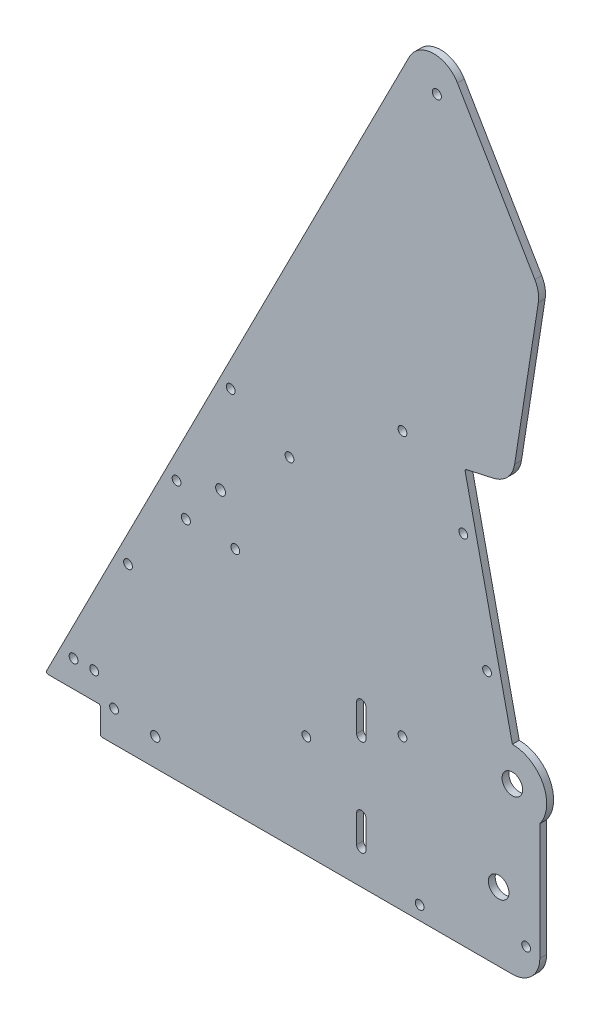
from build123d import *

# Parameters (mm, degrees)
BOSS_EXTRUDE1_DEPTH = 3.175
SKETCH2_R           = 2.0955
SKETCH2_R_2         = 2.286
SKETCH2_R_3         = 2.032
SKETCH2_R_4         = 4.7625
CUT_EXTRUDE1_DEPTH  = 421.976111717
SKETCH7_R           = 2.159
CUT_EXTRUDE2_DEPTH  = 421.976111717
CUT_EXTRUDE3_REACH  = 422.976
SKETCH10_R          = 2.032
FILLET1_R           = 12.7
FILLET2_R           = 0.79375
SKETCH12_R          = 2.032
CUT_EXTRUDE5_DEPTH  = 410.593447353


with BuildPart() as part:
    # Sketch1 → Boss-Extrude1 (new body)
    with BuildSketch(Plane.XY):
        with BuildLine():
            Line((228.6, -12.7), (228.6, 53.975))
            ThreePointArc((228.6, 53.975), (230.099031657, 70.599515829), (215.9, 79.375))
            Line((215.9, 79.375), (193.909735224, 178.566674323))
            Line((193.909735224, 178.566674323), (215.607913982, 183.377044743))
            Line((215.607913982, 183.377044743), (228.6, 266.7))
            Line((228.6, 266.7), (178.754725958, 351.413083686))
            Line((178.754725958, 351.413083686), (0, 0))
            Line((0, 0), (25.4, 0))
            Line((25.4, 0), (25.4, -12.7))
            Line((25.4, -12.7), (228.6, -12.7))
        make_face()
    extrude(amount=BOSS_EXTRUDE1_DEPTH)

    # Sketch2 → Cut-Extrude1 (cut, through all)
    with BuildSketch(Plane.XY.offset(3.175)):
        with Locations((64.943150167, 94.057839899)):
            Circle(SKETCH2_R)
        with Locations((180.975, 322.164313376)):
            Circle(SKETCH2_R)
        with Locations((81.00705334, 113.73297687)):
            Circle(SKETCH2_R_2)
        with Locations((193.207821773, 152.394364194)):
            Circle(SKETCH2_R_3)
        with Locations((215.9, 63.5)):
            Circle(SKETCH2_R_4)
        with Locations((173.0375, -6.35)):
            Circle(SKETCH2_R_3)
        with Locations((204.202954161, 102.798527032)):
            Circle(SKETCH2_R_3)
        with Locations((209.55, 19.05)):
            Circle(SKETCH2_R_4)
        with Locations((60.657757175, 107.341986975)):
            Circle(SKETCH2_R_3)
        with Locations((165.1, 179.3875)):
            Circle(SKETCH2_R_3)
        with Locations((87.824985877, 93.522721993)):
            Circle(SKETCH2_R_3)
        with Locations((112.872403657, 142.763324016)):
            Circle(SKETCH2_R_3)
        with Locations((85.705174955, 156.582588998)):
            Circle(SKETCH2_R_3)
    extrude(amount=-CUT_EXTRUDE1_DEPTH, mode=Mode.SUBTRACT)

    # Sketch7 → Cut-Extrude2 (cut, through all)
    with BuildSketch(Plane.XY.offset(3.175)):
        with Locations((50.8, 0)):
            Circle(SKETCH7_R)
        with BuildLine():
            Line((143.891, 3.175), (143.891, 15.875))
            ThreePointArc((143.891, 15.875), (146.05, 18.034), (148.209, 15.875))
            Line((148.209, 15.875), (148.209, 3.175))
            ThreePointArc((148.209, 3.175), (146.05, 1.016), (143.891, 3.175))
        make_face()
        with BuildLine():
            Line((143.891, 47.625), (143.891, 60.325))
            ThreePointArc((143.891, 60.325), (146.05, 62.484), (148.209, 60.325))
            Line((148.209, 60.325), (148.209, 47.625))
            ThreePointArc((148.209, 47.625), (146.05, 45.466), (143.891, 47.625))
        make_face()
    extrude(amount=-CUT_EXTRUDE2_DEPTH, mode=Mode.SUBTRACT)

    # Sketch10 → Cut-Extrude3 (cut, up to next)
    with BuildSketch(Plane.XY.offset(3.175), mode=Mode.PRIVATE) as cut_extrude3_sk1:
        with Locations((120.65, 34.925)):
            Circle(SKETCH10_R)
    cut_extrude3_tool1 = extrude(cut_extrude3_sk1.sketch, amount=-CUT_EXTRUDE3_REACH, mode=Mode.PRIVATE) & part.part
    # Sketch10 → Cut-Extrude3 (cut, up to next)
    with BuildSketch(Plane.XY.offset(3.175), mode=Mode.PRIVATE) as cut_extrude3_sk2:
        with Locations((165.1, 57.15)):
            Circle(SKETCH10_R)
    cut_extrude3_tool2 = extrude(cut_extrude3_sk2.sketch, amount=-CUT_EXTRUDE3_REACH, mode=Mode.PRIVATE) & part.part
    # Sketch10 → Cut-Extrude3 (cut, up to next)
    with BuildSketch(Plane.XY.offset(3.175), mode=Mode.PRIVATE) as cut_extrude3_sk3:
        with Locations((13.046467246, 12.334704411)):
            Circle(SKETCH10_R)
    cut_extrude3_tool3 = extrude(cut_extrude3_sk3.sketch, amount=-CUT_EXTRUDE3_REACH, mode=Mode.PRIVATE) & part.part
    # Sketch10 → Cut-Extrude3 (cut, up to next)
    with BuildSketch(Plane.XY.offset(3.175), mode=Mode.PRIVATE) as cut_extrude3_sk4:
        with Locations((22.571467246, 12.334704411)):
            Circle(SKETCH10_R)
    cut_extrude3_tool4 = extrude(cut_extrude3_sk4.sketch, amount=-CUT_EXTRUDE3_REACH, mode=Mode.PRIVATE) & part.part
    # Sketch10 → Cut-Extrude3 (cut, up to next)
    with BuildSketch(Plane.XY.offset(3.175), mode=Mode.PRIVATE) as cut_extrude3_sk5:
        with Locations((38.211447917, 62.639810909)):
            Circle(SKETCH10_R)
    cut_extrude3_tool5 = extrude(cut_extrude3_sk5.sketch, amount=-CUT_EXTRUDE3_REACH, mode=Mode.PRIVATE) & part.part
    add(cut_extrude3_tool1.solids().sort_by_distance((120.65, 34.925, 3.175))[0], mode=Mode.SUBTRACT)
    add(cut_extrude3_tool2.solids().sort_by_distance((165.1, 57.15, 3.175))[0], mode=Mode.SUBTRACT)
    add(cut_extrude3_tool3.solids().sort_by_distance((13.046467, 12.334704, 3.175))[0], mode=Mode.SUBTRACT)
    add(cut_extrude3_tool4.solids().sort_by_distance((22.571467, 12.334704, 3.175))[0], mode=Mode.SUBTRACT)
    add(cut_extrude3_tool5.solids().sort_by_distance((38.211448, 62.639811, 3.175))[0], mode=Mode.SUBTRACT)

    # Fillet1
    fillet1_edges = [part.edges().sort_by_distance(p)[0] for p in [
        (228.6, -12.7, 1.5875),
        (178.754725958, 351.413083686, 1.5875),
        (215.607913982, 183.377044743, 1.5875),
        (228.6, 266.7, 1.5875),
    ]]
    fillet(fillet1_edges, radius=FILLET1_R)

    # Fillet2
    fillet2_edges = [part.edges().sort_by_distance(p)[0] for p in [
        (25.4, -12.7, 1.5875),
        (25.4, 0, 1.5875),
        (193.909735224, 178.566674323, 1.5875),
        (0, 0, 1.5875),
    ]]
    fillet(fillet2_edges, radius=FILLET2_R)

    # Sketch12 → Cut-Extrude5 (cut, through all)
    with BuildSketch(Plane.XY.offset(3.175)):
        with Locations((31.75, 1.5875)):
            Circle(SKETCH12_R)
        with Locations((173.0375, -6.35)):
            Circle(SKETCH12_R)
        with Locations((222.25, 1.5875)):
            Circle(SKETCH12_R)
    extrude(amount=-CUT_EXTRUDE5_DEPTH, mode=Mode.SUBTRACT)


solid = part.part
